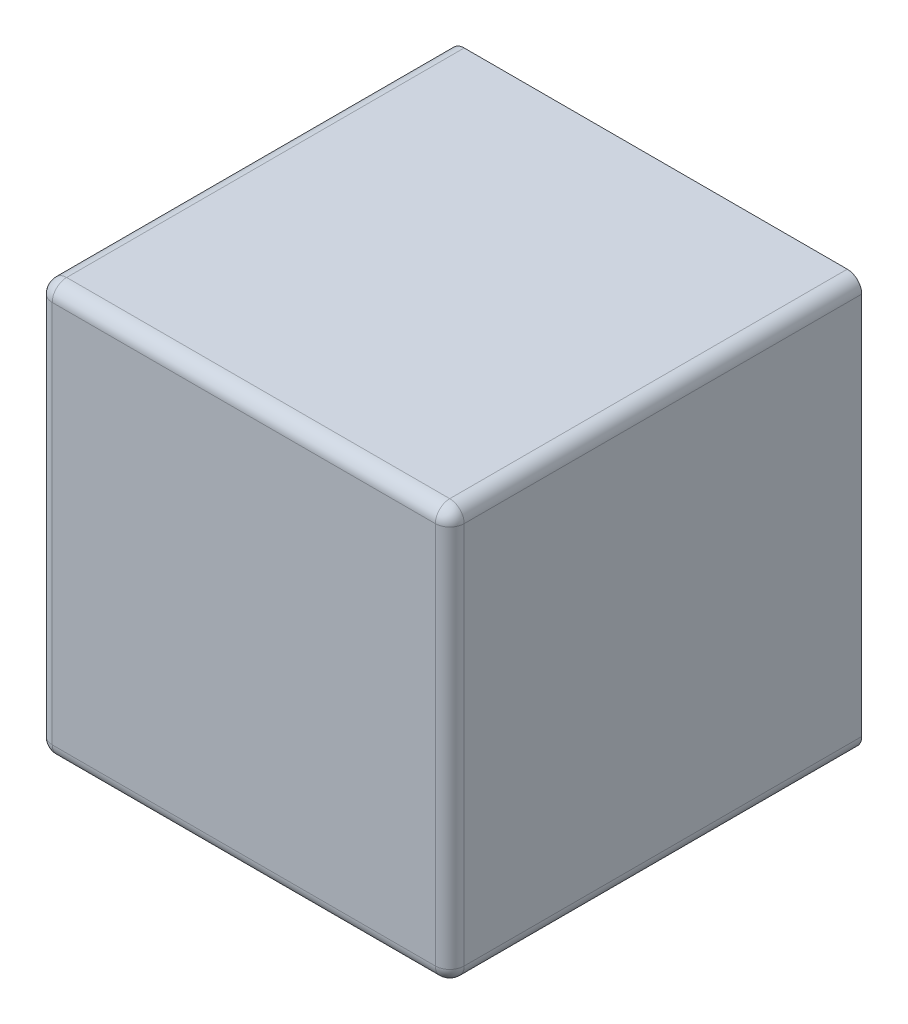
from build123d import *

# Parameters (mm, degrees)
ESBO_O1_W                = 200
ESBO_O1_H                = 200
RESSALTO_EXTRUS_O2_DEPTH = 200
ESBO_O4_W                = 91.052715104
ESBO_O4_H                = 180
ESBO_O4_W_2              = 83.947284896
ESBO_O4_H_2              = 68.664679647
ESBO_O4_H_3              = 106.335320353
CORTE_EXTRUS_O2_DEPTH    = 190
FILETE2_R                = 7
FILETE3_R                = 7
FILETE4_R                = 7
FILETE5_R                = 7
FILETE6_R                = 7
ESBO_O5_R                = 5
CORTE_EXTRUS_O3_DEPTH    = 10
ESBO_O6_R                = 10
CORTE_EXTRUS_O4_DEPTH    = 10


with BuildPart() as part:
    # Esboço1 → Ressalto-extrusão2 (new body)
    with BuildSketch(Plane.XY):
        with Locations((100, 100)):
            Rectangle(ESBO_O1_W, ESBO_O1_H)
    extrude(amount=RESSALTO_EXTRUS_O2_DEPTH)

    # Esboço4 → Corte-extrusão2 (cut)
    with BuildSketch(Plane(origin=(0, 0, 0), x_dir=(-1, 0, 0), z_dir=(0, 0, -1))):
        with Locations((-144.473642448, 100)):
            Rectangle(ESBO_O4_W, ESBO_O4_H)
        with Locations((-51.973642448, 44.332339823)):
            Rectangle(ESBO_O4_W_2, ESBO_O4_H_2)
        with Locations((-51.973642448, 136.832339824)):
            Rectangle(ESBO_O4_W_2, ESBO_O4_H_3)
    extrude(amount=-CORTE_EXTRUS_O2_DEPTH, mode=Mode.SUBTRACT)

    # Filete2
    filete2_edges = [part.edges().sort_by_distance(p)[0] for p in [
        (0, 0, 100),
        (0, 200, 100),
        (200, 200, 100),
        (200, 0, 100),
    ]]
    fillet(filete2_edges, radius=FILETE2_R)

    # Filete3
    filete3_edges = [part.edges().sort_by_distance(p)[0] for p in [
        (190, 10, 95),
        (190, 190, 95),
        (98.947284896, 190, 95),
        (98.947284896, 10, 95),
        (93.947284896, 10, 95),
        (93.947284896, 78.664679647, 95),
        (10, 78.664679647, 95),
        (10, 10, 95),
        (10, 190, 95),
        (10, 83.664679647, 95),
    ]]
    fillet(filete3_edges, radius=FILETE3_R)

    # Filete4
    filete4_edges = [part.edges().sort_by_distance(p)[0] for p in [
        (12.050252532, 187.949747468, 190),
        (12.050252532, 85.714932179, 190),
        (93.947284896, 136.832339824, 190),
        (55.473642448, 83.664679647, 190),
        (93.947284896, 44.332339824, 190),
        (51.973642448, 78.664679647, 190),
        (51.973642448, 10, 190),
        (10, 44.332339824, 190),
        (12.050252532, 12.050252532, 190),
        (12.050252532, 76.614427115, 190),
        (91.897032365, 12.050252532, 190),
        (91.897032365, 76.614427115, 190),
        (190, 100, 190),
        (144.473642448, 190, 190),
        (144.473642448, 10, 190),
        (98.947284896, 100, 190),
        (100.997537428, 187.949747468, 190),
        (100.997537428, 12.050252532, 190),
        (187.949747468, 12.050252532, 190),
        (187.949747468, 187.949747468, 190),
        (10, 136.832339824, 190),
        (55.473642448, 190, 190),
    ]]
    fillet(filete4_edges, radius=FILETE4_R)

    # Filete5
    filete5_edges = [part.edges().sort_by_distance(p)[0] for p in [
        (0, 100, 200),
        (100, 200, 200),
        (100, 0, 200),
        (200, 100, 200),
        (197.949747468, 2.050252532, 200),
        (2.050252532, 2.050252532, 200),
        (197.949747468, 197.949747468, 200),
        (2.050252532, 197.949747468, 200),
    ]]
    fillet(filete5_edges, radius=FILETE5_R)

    # Filete6
    # the kernel refuses this fillet: 7 mm, written as the material it adds along each edge
    with BuildSketch(Plane(origin=(86.947284896, 183, 183), x_dir=(1, 0, 0), z_dir=(0, 1, 0))) as filete6_piece_1_section:
        Polygon((0, 0), (FILETE6_R * 1.02, 0), (FILETE6_R * 1.02, -FILETE6_R * 1.02), (0, -FILETE6_R * 1.02), align=None)
    filete6_piece_1 = extrude(amount=FILETE6_R * 1.02, mode=Mode.PRIVATE)
    filete6_piece_1 = filete6_piece_1 - Plane(origin=(86.947284896, 183, 183), x_dir=(-0.7071067811865475, 0, -0.7071067811865475), z_dir=(0, 1, 0)) * Sphere(FILETE6_R, mode=Mode.PRIVATE)
    add(filete6_piece_1)
    with BuildSketch(Plane(origin=(86.947284896, 90.664679647, 183), x_dir=(0, -1, 0), z_dir=(1, 0, 0))) as filete6_piece_2_section:
        Polygon((0, 0), (FILETE6_R * 1.02, 0), (FILETE6_R * 1.02, -FILETE6_R * 1.02), (0, -FILETE6_R * 1.02), align=None)
    filete6_piece_2 = extrude(amount=FILETE6_R * 1.02, mode=Mode.PRIVATE)
    filete6_piece_2 = filete6_piece_2 - Plane(origin=(86.947284896, 90.664679647, 183), x_dir=(0, 0.7071067811865475, -0.7071067811865475), z_dir=(1, 0, 0)) * Sphere(FILETE6_R, mode=Mode.PRIVATE)
    add(filete6_piece_2)
    with BuildSketch(Plane(origin=(93.947284896, 83.664679647, 0), x_dir=(0, 1, 0), z_dir=(0, 0, 1)), Plane(origin=(93.947284896, 190, 0), x_dir=(-1, 0, 0), z_dir=(0, 0, 1))) as filete6_piece_3:
        with BuildLine():
            CenterArc((FILETE6_R, FILETE6_R), FILETE6_R, 180, 90)
            Line((0, FILETE6_R), (0, 0))
            Line((0, 0), (FILETE6_R, 0))
        make_face()
    extrude(amount=183)

    # Esboço5 → Corte-extrusão3 (cut)
    with BuildSketch(Plane(origin=(0, 83.664679647, 0), x_dir=(1, 0, 0), z_dir=(0, 1, 0))):
        with Locations(Location((53.753482912, -10, 0), (0, 0, 270))):
            Circle(ESBO_O5_R)
    extrude(amount=-CORTE_EXTRUS_O3_DEPTH, mode=Mode.SUBTRACT)

    # Esboço6 → Corte-extrusão4 (cut)
    with BuildSketch(Plane.ZY):
        with Locations((173, 172.46544245)):
            Circle(ESBO_O6_R)
    extrude(amount=-CORTE_EXTRUS_O4_DEPTH, mode=Mode.SUBTRACT)


solid = part.part
